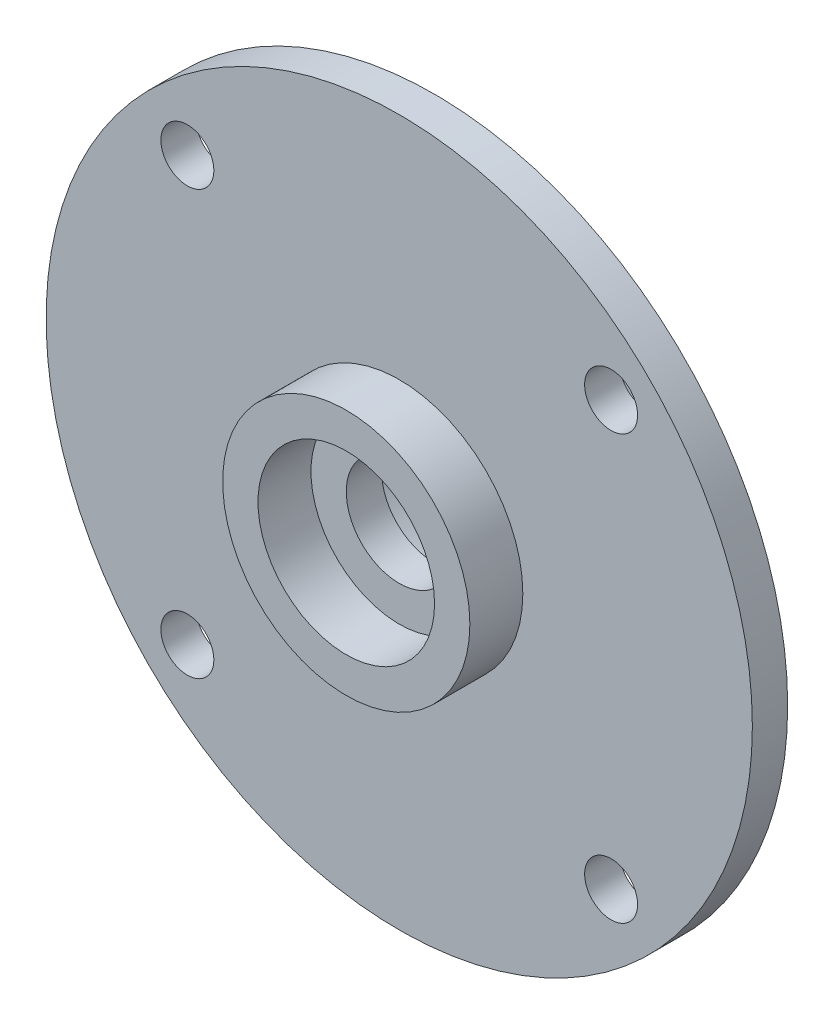
from build123d import *

# Parameters (mm, degrees)
SKETCH_1_R      = 20
SKETCH_1_R_2    = 1.5
SKETCH_1_R_3    = 3
EXTRUDE_1_DEPTH = 2
SKETCH_3_R      = 11
SKETCH_3_R_2    = 7.5
EXTRUDE_2_DEPTH = 5
SKETCH_2_R      = 7
SKETCH_2_R_2    = 5
EXTRUDE_3_DEPTH = 3


with BuildPart() as part:
    # 草图1 → 凸台-拉伸1 (new body)
    with BuildSketch(Plane.XY):
        Circle(SKETCH_1_R)
        with Locations((-12, 12)):
            Circle(SKETCH_1_R_2, mode=Mode.SUBTRACT)
        with Locations((12, 12)):
            Circle(SKETCH_1_R_2, mode=Mode.SUBTRACT)
        with Locations((12, -12)):
            Circle(SKETCH_1_R_2, mode=Mode.SUBTRACT)
        with Locations((-12, -12)):
            Circle(SKETCH_1_R_2, mode=Mode.SUBTRACT)
        Circle(SKETCH_1_R_3, mode=Mode.SUBTRACT)
    extrude(amount=EXTRUDE_1_DEPTH)

    # 草图3 → 凸台-拉伸2 (add)
    with BuildSketch(Plane(origin=(0, 0, 0), x_dir=(-1, 0, 0), z_dir=(0, 0, -1))):
        Circle(SKETCH_3_R)
        Circle(SKETCH_3_R_2, mode=Mode.SUBTRACT)
    extrude(amount=EXTRUDE_2_DEPTH)

    # 草图2 → 凸台-拉伸3 (add)
    with BuildSketch(Plane.XY.offset(2)):
        Circle(SKETCH_2_R)
        Circle(SKETCH_2_R_2, mode=Mode.SUBTRACT)
    extrude(amount=EXTRUDE_3_DEPTH)


solid = part.part
